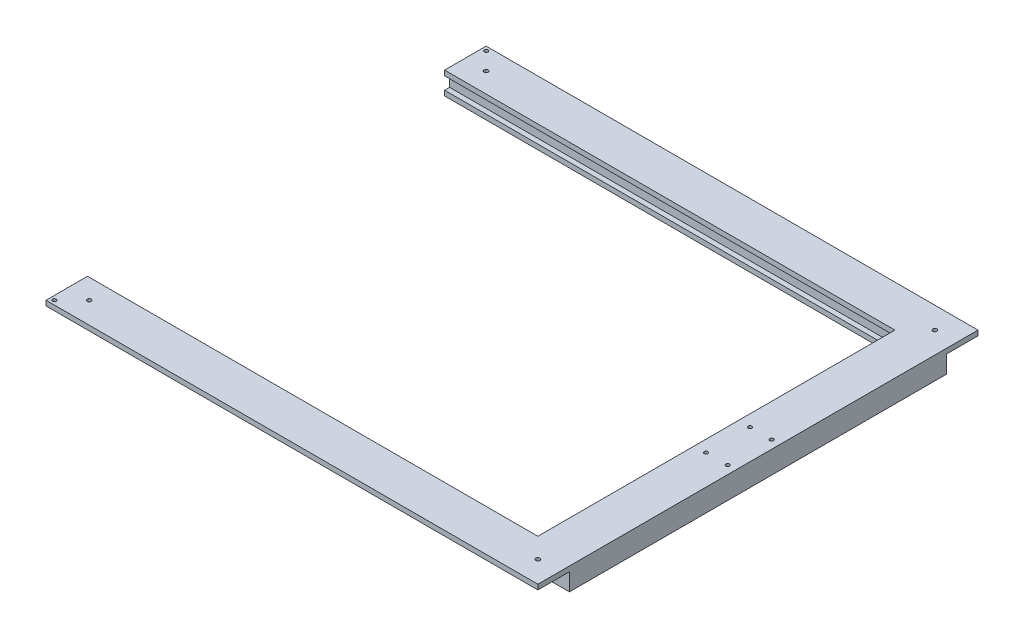
from build123d import *

# Parameters (mm, degrees)
EXTRUDE_2_DEPTH             = 6
EXTRUDE_3_DEPTH             = 15
SKETCH_4_R                  = 2.5
CUT_EXTRUDE_1_DEPTH         = 815.922603695
PATTERN_LINEAR_2_COUNT      = 2
PATTERN_LINEAR_2_PITCH      = 540.3
PATTERN_LINEAR_2_COUNT_DIR2 = 2
PATTERN_LINEAR_2_PITCH_DIR2 = 478
EXTRUDE_4_DEPTH             = 6
SKETCH_6_R                  = 2.25
CUT_EXTRUDE_2_DEPTH         = 816.099288438
SKETCH_7_R                  = 2.25
CUT_EXTRUDE_3_DEPTH         = 815.922603695


with BuildPart() as part:
    # Эскиз1 → Бобышка-Вытянуть2 (new body)
    with BuildSketch(Plane(origin=(0, 0, 0), x_dir=(1, 0, 0), z_dir=(0, 1, 0))):
        Polygon((50, -77.921508101), (50, -607.921508101), (-542.3, -607.921508101), (-542.3, -557.921508101), (0, -557.921508101), (0, -127.921508101), (-542.3, -127.921508101), (-542.3, -77.921508101), align=None)
    extrude(amount=EXTRUDE_2_DEPTH)

    # Эскиз2 → Бобышка-Вытянуть3 (add)
    with BuildSketch(Plane.XZ):
        Polygon((50, 569.921508101), (50, 115.921508101), (-542.3, 115.921508101), (-542.3, 121.921508101), (6, 121.921508101), (6, 563.921508101), (-542.3, 563.921508101), (-542.3, 569.921508101), align=None)
    extrude(amount=EXTRUDE_3_DEPTH)

    # Эскиз4 → Вырез-Вытянуть1 (cut, through all)
    with BuildSketch(Plane(origin=(0, 6, 0), x_dir=(1, 0, 0), z_dir=(0, 1, 0))):
        with Locations((-516.3, -103.921508101)):
            Circle(SKETCH_4_R)
    cut_extrude_1 = extrude(amount=-CUT_EXTRUDE_1_DEPTH, mode=Mode.SUBTRACT)

    # Линейный массив2: Cut-Extrude 1 2 × 2
    with Locations(*[(i * PATTERN_LINEAR_2_PITCH, 0, j * PATTERN_LINEAR_2_PITCH_DIR2) for i in range(PATTERN_LINEAR_2_COUNT) for j in range(PATTERN_LINEAR_2_COUNT_DIR2) if (i, j) != (0, 0)]):
        add(cut_extrude_1, mode=Mode.SUBTRACT)

    # Эскиз5 → Бобышка-Вытянуть4 (add)
    with BuildSketch(Plane.XZ.offset(15)):
        Polygon((50, 569.921508101), (-542.3, 569.921508101), (-542.3, 557.921508101), (0, 557.921508101), (0, 127.921508101), (-542.3, 127.921508101), (-542.3, 115.921508101), (50, 115.921508101), align=None)
    extrude(amount=EXTRUDE_4_DEPTH)

    # Эскиз6 → Вырез-Вытянуть2 (cut, through all)
    with BuildSketch(Plane.XZ.offset(21)):
        with Locations((14, 369.421508101)):
            Circle(SKETCH_6_R)
        with Locations((40, 369.421508101)):
            Circle(SKETCH_6_R)
        with Locations((40, 316.421508101)):
            Circle(SKETCH_6_R)
        with Locations((14, 316.421508101)):
            Circle(SKETCH_6_R)
    extrude(amount=-CUT_EXTRUDE_2_DEPTH, mode=Mode.SUBTRACT)

    # Эскиз7 → Вырез-Вытянуть3 (cut, through all)
    with BuildSketch(Plane.XZ):
        with Locations((-537.3, 602.921508101)):
            Circle(SKETCH_7_R)
        with Locations((-537.3, 82.921508101)):
            Circle(SKETCH_7_R)
    extrude(amount=-CUT_EXTRUDE_3_DEPTH, mode=Mode.SUBTRACT)


solid = part.part
